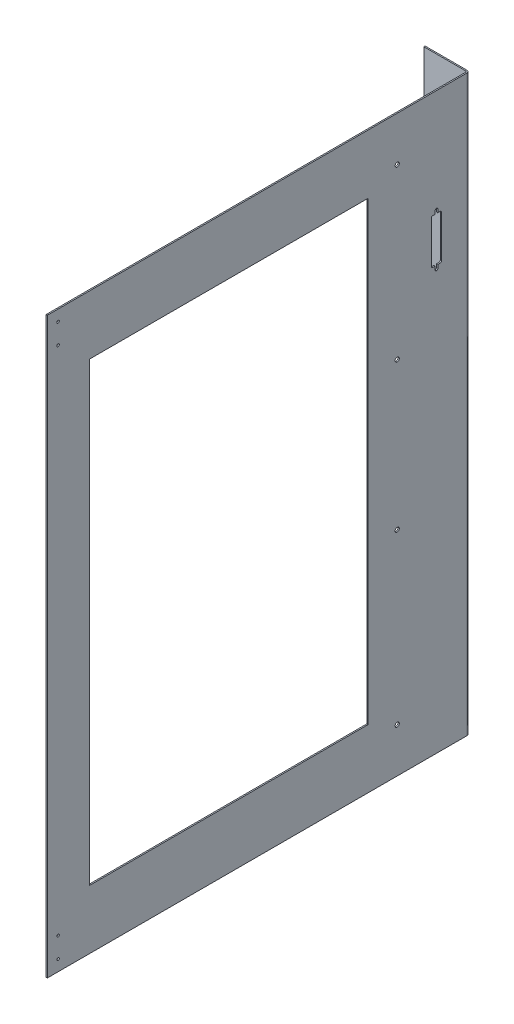
from build123d import *

# Parameters (mm, degrees)
SKETCH1_W                  = 680
SKETCH1_H                  = 550
SKETCH1_R                  = 1.5
BOSS_EXTRUDE1_DEPTH        = 1.3
SKETCH3_W                  = 540
SKETCH3_H                  = 330
CUT_EXTRUDE1_DEPTH         = 438.878125167
F_5_0_5_DIAMETER_HOLE1_D   = 5
CONVERT_SOLID1_START       = -0.2
CONVERT_SOLID1_OUTLINE_W   = 680
CONVERT_SOLID1_OUTLINE_H   = 550
CONVERT_SOLID1_OUTLINE_R   = 2.5
CONVERT_SOLID1_OUTLINE_R_2 = 1.5
CONVERT_SOLID1_OUTLINE_W_2 = 540
CONVERT_SOLID1_OUTLINE_H_2 = 330
CONVERT_SOLID1_DEPTH       = 0.2
SKETCHED_START             = -339.25
SKETCHED_BEND1_DEPTH       = 680
SKETCHED_BEND1_2_DEPTH     = 680
F_5_0_5_DIAMETER_HOLE2_D   = 5
CUT_EXTRUDE2_DEPTH         = 442.008177978
FILLET4_R                  = 1.5
FILLET5_R                  = 1.5
FILLET6_R                  = 1.5
FILLET7_R                  = 1.5
FILLET8_R                  = 1.5
FILLET9_R                  = 1.5
FILLET10_R                 = 1.5
FILLET11_R                 = 1.5


# Read off the part's stored shape, not the designer's step: Convert-Solid1, Sketched Bend1
with BuildPart() as part:
    # Sketch1 → Boss-Extrude1 (new body)
    with BuildSketch(Plane.YZ):
        with Locations((0.75, 0)):
            Rectangle(SKETCH1_W, SKETCH1_H)
        with Locations(Location((-326.141480577, 262.3, 0), (0, 0, 270))):
            Circle(SKETCH1_R, mode=Mode.SUBTRACT)
        with Locations(Location((-302.039034574, 262.3, 0), (0, 0, 270))):
            Circle(SKETCH1_R, mode=Mode.SUBTRACT)
        with Locations(Location((327.641480577, 262.3, 0), (0, 0, 270))):
            Circle(SKETCH1_R, mode=Mode.SUBTRACT)
        with Locations(Location((303.539034574, 262.3, 0), (0, 0, 270))):
            Circle(SKETCH1_R, mode=Mode.SUBTRACT)
    extrude(amount=BOSS_EXTRUDE1_DEPTH)

    # Sketch3 → Cut-Extrude1 (cut, through all)
    with BuildSketch(Plane.YZ.offset(1.3)):
        with Locations((0.75, 59.995312317)):
            Rectangle(SKETCH3_W, SKETCH3_H)
    extrude(amount=-CUT_EXTRUDE1_DEPTH, mode=Mode.SUBTRACT)

    # Ø5.0 (5) Diameter Hole1 (through all)
    with Locations(Plane.YZ.offset(1.3)):
        with Locations((288.05, -139.45), (-286.55, -139.45), (-86.55, -139.45), (88.05, -139.45)):
            Hole(F_5_0_5_DIAMETER_HOLE1_D / 2)

    # Convert-Solid1 outline → Convert-Solid1 (add)
    with BuildSketch(Plane.YZ.offset(CONVERT_SOLID1_START)):
        with Locations((0.75, 0)):
            Rectangle(CONVERT_SOLID1_OUTLINE_W, CONVERT_SOLID1_OUTLINE_H)
        with Locations((-286.55, -139.45)):
            Circle(CONVERT_SOLID1_OUTLINE_R, mode=Mode.SUBTRACT)
        with Locations((-86.55, -139.45)):
            Circle(CONVERT_SOLID1_OUTLINE_R, mode=Mode.SUBTRACT)
        with Locations((88.05, -139.45)):
            Circle(CONVERT_SOLID1_OUTLINE_R, mode=Mode.SUBTRACT)
        with Locations((288.05, -139.45)):
            Circle(CONVERT_SOLID1_OUTLINE_R, mode=Mode.SUBTRACT)
        with Locations((-326.141480577, 262.3)):
            Circle(CONVERT_SOLID1_OUTLINE_R_2, mode=Mode.SUBTRACT)
        with Locations((-302.039034574, 262.3)):
            Circle(CONVERT_SOLID1_OUTLINE_R_2, mode=Mode.SUBTRACT)
        with Locations((0.75, 59.995312317)):
            Rectangle(CONVERT_SOLID1_OUTLINE_W_2, CONVERT_SOLID1_OUTLINE_H_2, mode=Mode.SUBTRACT)
        with Locations((303.539034574, 262.3)):
            Circle(CONVERT_SOLID1_OUTLINE_R_2, mode=Mode.SUBTRACT)
        with Locations((327.641480577, 262.3)):
            Circle(CONVERT_SOLID1_OUTLINE_R_2, mode=Mode.SUBTRACT)
    extrude(amount=CONVERT_SOLID1_DEPTH)

    # Sketched Bend1 outline → Sketched Bend1 (cut)
    with BuildSketch(Plane(origin=(0, 0, 0), x_dir=(1, 0, 0), z_dir=(0, 1, 0)).offset(SKETCHED_START)):
        with BuildLine():
            Line((-0.2, 275), (-0.2, 224.598076212))
            ThreePointArc((-0.2, 224.598076212), (0.898076212, 223.5), (1.3, 222))
            Line((1.3, 222), (1.3, 275))
            Line((1.3, 275), (-0.2, 275))
        make_face()
    extrude(amount=SKETCHED_BEND1_DEPTH, mode=Mode.SUBTRACT)

    # Sketched Bend1 2 outline → Sketched Bend1 2 (add)
    with BuildSketch(Plane(origin=(0, 0, 0), x_dir=(1, 0, 0), z_dir=(0, 1, 0)).offset(SKETCHED_START)):
        with BuildLine():
            Line((-51.165708265, 225), (-51.165708265, 223.5))
            Line((-51.165708265, 223.5), (-1.7, 223.5))
            ThreePointArc((-1.7, 223.5), (-0.639339828, 223.060660172), (-0.2, 222))
            Line((-0.2, 222), (-0.2, 224.598076212))
            ThreePointArc((-0.2, 224.598076212), (-0.923542865, 224.897777479), (-1.7, 225))
            Line((-1.7, 225), (-51.165708265, 225))
        make_face()
    extrude(amount=SKETCHED_BEND1_2_DEPTH)

    # Ø5.0 (5) Diameter Hole2 (through all)
    with Locations(Plane(origin=(0, 0, -223.5), x_dir=(0, -1, 0), z_dir=(0, 0, 1))):
        with Locations((-288.05, -26.165708265), (-88.05, -26.165708265), (86.55, -26.165708265), (286.55, -26.165708265)):
            Hole(F_5_0_5_DIAMETER_HOLE2_D / 2)

    # Sketch15 → Cut-Extrude2 (cut, through all)
    with BuildSketch(Plane.YZ.offset(1.3)):
        Polygon((161.5, -180), (214.6, -180), (214.6, -184.45), (220.1, -184.45), (220.1, -187.55), (214.6, -187.55), (214.6, -192), (161.5, -192), (161.5, -187.55), (156, -187.55), (156, -184.45), (161.5, -184.45), align=None)
    extrude(amount=-CUT_EXTRUDE2_DEPTH, mode=Mode.SUBTRACT)

    # Fillet4
    fillet4_edges = [part.edges().sort_by_distance(p)[0] for p in [
        (0.55, 161.5, -180),
    ]]
    fillet(fillet4_edges, radius=FILLET4_R)

    # Fillet5
    fillet5_edges = [part.edges().sort_by_distance(p)[0] for p in [
        (0.55, 214.6, -180),
    ]]
    fillet(fillet5_edges, radius=FILLET5_R)

    # Fillet6
    fillet6_edges = [part.edges().sort_by_distance(p)[0] for p in [
        (0.55, 220.1, -184.45),
    ]]
    fillet(fillet6_edges, radius=FILLET6_R)

    # Fillet7
    fillet7_edges = [part.edges().sort_by_distance(p)[0] for p in [
        (0.55, 220.1, -187.55),
    ]]
    fillet(fillet7_edges, radius=FILLET7_R)

    # Fillet8
    fillet8_edges = [part.edges().sort_by_distance(p)[0] for p in [
        (0.55, 214.6, -192),
    ]]
    fillet(fillet8_edges, radius=FILLET8_R)

    # Fillet9
    fillet9_edges = [part.edges().sort_by_distance(p)[0] for p in [
        (0.55, 161.5, -192),
    ]]
    fillet(fillet9_edges, radius=FILLET9_R)

    # Fillet10
    fillet10_edges = [part.edges().sort_by_distance(p)[0] for p in [
        (0.55, 156, -184.45),
    ]]
    fillet(fillet10_edges, radius=FILLET10_R)

    # Fillet11
    fillet11_edges = [part.edges().sort_by_distance(p)[0] for p in [
        (0.55, 156, -187.55),
    ]]
    fillet(fillet11_edges, radius=FILLET11_R)


solid = part.part
